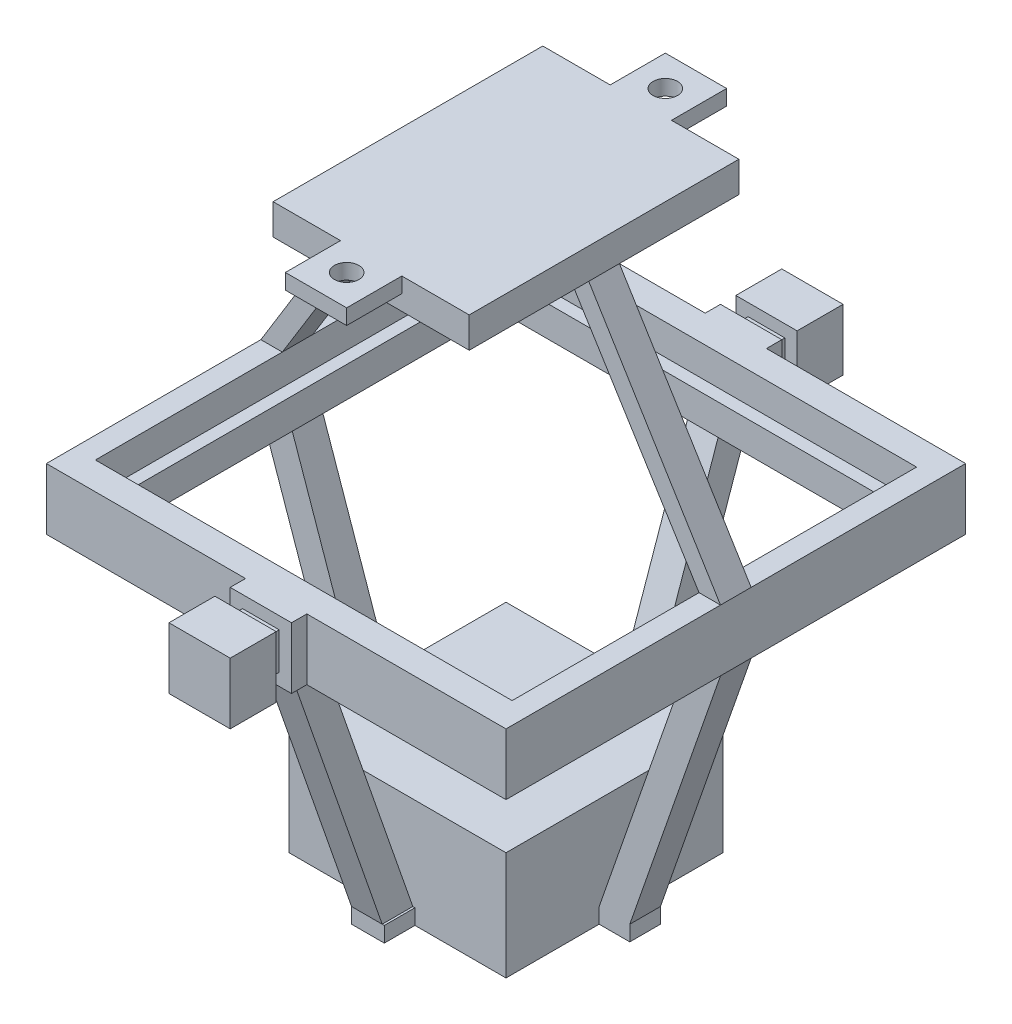
from build123d import *

# Parameters (mm, degrees)
SKETCH2_W                   = 75
SKETCH2_H                   = 75
BOSS_EXTRUDE1_DEPTH         = 5
SKETCH2_2_W                 = 75
SKETCH2_2_H                 = 75
BOSS_EXTRUDE2_DEPTH         = 5
SKETCH4_W                   = 68
SKETCH4_H                   = 66
CUT_EXTRUDE1_DEPTH          = 5
SKETCH5_W                   = 64
SKETCH5_H                   = 62
CUT_EXTRUDE2_DEPTH          = 5
SKETCH6_W                   = 10
SKETCH6_H                   = 10
BOSS_EXTRUDE3_DEPTH         = 2.5
SKETCH7_W                   = 6
SKETCH7_H                   = 6
BOSS_EXTRUDE4_DEPTH         = 2.5
SKETCH8_W                   = 10
SKETCH8_H                   = 10
BOSS_EXTRUDE5_DEPTH         = 7.5
SKETCH9_W                   = 10
SKETCH9_H                   = 10
BOSS_EXTRUDE6_DEPTH         = 2.5
SKETCH10_W                  = 6
SKETCH10_H                  = 6
BOSS_EXTRUDE7_DEPTH         = 2.5
SKETCH11_W                  = 10
SKETCH11_H                  = 10
BOSS_EXTRUDE8_DEPTH         = 7.5
SKETCH14_W                  = 35.4
SKETCH14_H                  = 35.4
BOSS_EXTRUDE9_DEPTH         = 17.7
SKETCH15_W                  = 25.4
SKETCH15_H                  = 25.4
CUT_EXTRUDE3_DEPTH          = 12.7
SKETCH16_W                  = 32
SKETCH16_H                  = 44
BOSS_EXTRUDE10_DEPTH        = 5
SKETCH18_W                  = 10
SKETCH18_H                  = 9
BOSS_EXTRUDE12_DEPTH        = 2.5
BOSS_EXTRUDE13_DEPTH        = 2.5
BOSS_EXTRUDE14_DEPTH        = 2.5
SKETCH31_R                  = 2
CHARGER_SUPPORT_HOLES_DEPTH = 2.5
SKETCH27_W                  = 5
SKETCH27_H                  = 5
SKETCH27_W_2                = 5.344431893
EYEBOLT_BOLT_SUPPORTS_DEPTH = 2.5
BOSS_EXTRUDE15_DEPTH        = 2.5
BOSS_EXTRUDE16_DEPTH        = 2.5
BOSS_EXTRUDE17_DEPTH        = 2.5
BOSS_EXTRUDE18_DEPTH        = 2.5


with BuildPart() as part:
    # Sketch2 → Boss-Extrude1 (new body)
    with BuildSketch(Plane(origin=(0, 0, 0), x_dir=(1, 0, 0), z_dir=(0, 1, 0))):
        Rectangle(SKETCH2_W, SKETCH2_H)
    extrude(amount=BOSS_EXTRUDE1_DEPTH)

    # Sketch2<2> → Boss-Extrude2 (add)
    with BuildSketch(Plane(origin=(0, 0, 0), x_dir=(1, 0, 0), z_dir=(0, 1, 0))):
        Rectangle(SKETCH2_2_W, SKETCH2_2_H)
    extrude(amount=-BOSS_EXTRUDE2_DEPTH)

    # Sketch4 → Cut-Extrude1 (cut)
    with BuildSketch(Plane(origin=(0, 5, 0), x_dir=(1, 0, 0), z_dir=(0, 1, 0))):
        Rectangle(SKETCH4_W, SKETCH4_H)
    extrude(amount=-CUT_EXTRUDE1_DEPTH, mode=Mode.SUBTRACT)

    # Sketch5 → Cut-Extrude2 (cut)
    with BuildSketch(Plane(origin=(0, 0, 0), x_dir=(1, 0, 0), z_dir=(0, 1, 0))):
        Rectangle(SKETCH5_W, SKETCH5_H)
    extrude(amount=-CUT_EXTRUDE2_DEPTH, mode=Mode.SUBTRACT)

    # Sketch6 → Boss-Extrude3 (add)
    with BuildSketch(Plane.XY.offset(37.5)):
        Rectangle(SKETCH6_W, SKETCH6_H)
    extrude(amount=BOSS_EXTRUDE3_DEPTH)

    # Sketch7 → Boss-Extrude4 (add)
    with BuildSketch(Plane.XY.offset(40)):
        Rectangle(SKETCH7_W, SKETCH7_H)
    extrude(amount=BOSS_EXTRUDE4_DEPTH)

    # Sketch8 → Boss-Extrude5 (add)
    with BuildSketch(Plane.XY.offset(42.5)):
        Rectangle(SKETCH8_W, SKETCH8_H)
    extrude(amount=BOSS_EXTRUDE5_DEPTH)

    # Sketch9 → Boss-Extrude6 (add)
    with BuildSketch(Plane(origin=(0, 0, -37.5), x_dir=(-1, 0, 0), z_dir=(0, 0, -1))):
        Rectangle(SKETCH9_W, SKETCH9_H)
    extrude(amount=BOSS_EXTRUDE6_DEPTH)

    # Sketch10 → Boss-Extrude7 (add)
    with BuildSketch(Plane(origin=(0, 0, -40), x_dir=(-1, 0, 0), z_dir=(0, 0, -1))):
        Rectangle(SKETCH10_W, SKETCH10_H)
    extrude(amount=BOSS_EXTRUDE7_DEPTH)

    # Sketch11 → Boss-Extrude8 (add)
    with BuildSketch(Plane(origin=(0, 0, -42.5), x_dir=(-1, 0, 0), z_dir=(0, 0, -1))):
        Rectangle(SKETCH11_W, SKETCH11_H)
    extrude(amount=BOSS_EXTRUDE8_DEPTH)



with BuildPart() as body_2:
    # Sketch14 → Boss-Extrude9 (new body)
    with BuildSketch(Plane(origin=(0, -50, 0), x_dir=(1, 0, 0), z_dir=(0, 1, 0))):
        Rectangle(SKETCH14_W, SKETCH14_H)
    extrude(amount=BOSS_EXTRUDE9_DEPTH)

    # Sketch15 → Cut-Extrude3 (cut)
    with BuildSketch(Plane.XZ.offset(50)):
        Rectangle(SKETCH15_W, SKETCH15_H)
    extrude(amount=-CUT_EXTRUDE3_DEPTH, mode=Mode.SUBTRACT)

    # Sketch27 → Eyebolt Bolt Supports (add)
    with BuildSketch(Plane(origin=(0, -50, 0), x_dir=(-1, 0, 0), z_dir=(0, -1, 0))):
        with Locations((-20.2, 0)):
            Rectangle(SKETCH27_W, SKETCH27_H)
        with Locations((20.2, 0)):
            Rectangle(SKETCH27_W, SKETCH27_H)
        with Locations((-0.172215947, -20.2)):
            Rectangle(SKETCH27_W_2, SKETCH27_H)
        with Locations((0, 20.2)):
            Rectangle(SKETCH27_W, SKETCH27_H)
    extrude(amount=-EYEBOLT_BOLT_SUPPORTS_DEPTH)


with BuildPart() as body_3:
    # Sketch16 → Boss-Extrude10 (new body)
    with BuildSketch(Plane(origin=(0, 45, 0), x_dir=(1, 0, 0), z_dir=(0, 1, 0))):
        Rectangle(SKETCH16_W, SKETCH16_H)
    extrude(amount=-BOSS_EXTRUDE10_DEPTH)

    # Sketch18 → Boss-Extrude12 (add)
    with BuildSketch(Plane(origin=(0, 45, 0), x_dir=(1, 0, 0), z_dir=(0, 1, 0))):
        with Locations((0, 26.5)):
            Rectangle(SKETCH18_W, SKETCH18_H)
        with Locations((0, -26.5)):
            Rectangle(SKETCH18_W, SKETCH18_H)
    extrude(amount=-BOSS_EXTRUDE12_DEPTH)


with BuildPart() as part_1:
    add(part.part)

    add(body_3.part)  # Boss-Extrude13 merges body 3
    # Sketch21 → Boss-Extrude13 (add)
    with BuildSketch(Plane.XY):
        Polygon((-37.5, 5), (-34, 5), (-12.434815796, 40), (-16, 40), align=None)
        Polygon((37.5, 5), (34, 5), (12.245590879, 40), (16, 40), align=None)
    extrude(amount=BOSS_EXTRUDE13_DEPTH)

    # Sketch21<2> → Boss-Extrude14 (add)
    with BuildSketch(Plane.XY):
        Polygon((-37.5, 5), (-34, 5), (-12.434815796, 40), (-16, 40), align=None)
        Polygon((37.5, 5), (34, 5), (12.245590879, 40), (16, 40), align=None)
    extrude(amount=-BOSS_EXTRUDE14_DEPTH)

    # Sketch31 → Charger Support Holes (cut)
    with BuildSketch(Plane(origin=(0, 45, 0), x_dir=(1, 0, 0), z_dir=(0, 1, 0))):
        with Locations((0, 26)):
            Circle(SKETCH31_R)
        with Locations((0, -26)):
            Circle(SKETCH31_R)
    extrude(amount=-CHARGER_SUPPORT_HOLES_DEPTH, mode=Mode.SUBTRACT)


    add(body_2.part)  # Boss-Extrude15 merges body 2
    # Sketch28 → Boss-Extrude15 (add)
    with BuildSketch(Plane.XY):
        Polygon((22.7, -47.5), (37.5, -5), (32.5, -5), (17.7, -47.5), align=None)
        Polygon((-22.7, -47.5), (-37.5, -5), (-32.5, -5), (-17.7, -47.5), align=None)
    extrude(amount=BOSS_EXTRUDE15_DEPTH)

    # Sketch28<2> → Boss-Extrude16 (add)
    with BuildSketch(Plane.XY):
        Polygon((22.7, -47.5), (37.5, -5), (32.5, -5), (17.7, -47.5), align=None)
        Polygon((-22.7, -47.5), (-37.5, -5), (-32.5, -5), (-17.7, -47.5), align=None)
    extrude(amount=-BOSS_EXTRUDE16_DEPTH)

    # Sketch30 → Boss-Extrude17 (add)
    with BuildSketch(Plane(origin=(0, 0, 0), x_dir=(0, 0, -1), z_dir=(1, 0, 0))):
        Polygon((22.7, -47.5), (37.5, -5), (32.5, -5), (17.7, -47.5), align=None)
        Polygon((-37.5, -5), (-22.7, -47.5), (-17.7, -47.5), (-32.5, -5), align=None)
    extrude(amount=BOSS_EXTRUDE17_DEPTH)

    # Sketch30<2> → Boss-Extrude18 (add)
    with BuildSketch(Plane(origin=(0, 0, 0), x_dir=(0, 0, -1), z_dir=(1, 0, 0))):
        Polygon((22.7, -47.5), (37.5, -5), (32.5, -5), (17.7, -47.5), align=None)
        Polygon((-37.5, -5), (-22.7, -47.5), (-17.7, -47.5), (-32.5, -5), align=None)
    extrude(amount=-BOSS_EXTRUDE18_DEPTH)


solid = part_1.part
